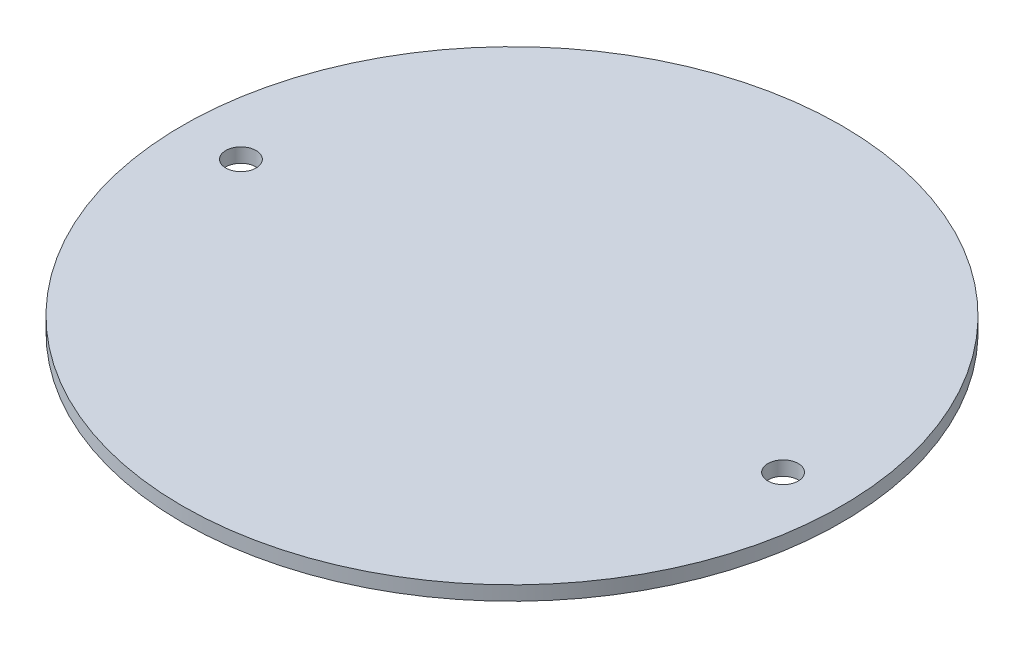
from build123d import *

# Parameters (mm, degrees)
SKETCH2_R               = 73.3425
BOSS_EXTRUDE1_DEPTH     = 3.175
F_1_4_CLEARANCE_HOLE1_D = 6.7564


with BuildPart() as part:
    # Sketch2 → Boss-Extrude1 (new body)
    with BuildSketch(Plane(origin=(0, 0, 0), x_dir=(1, 0, 0), z_dir=(0, 1, 0))):
        Circle(SKETCH2_R)
    extrude(amount=BOSS_EXTRUDE1_DEPTH)

    # 1/4 Clearance Hole1 (through all)
    with Locations(Plane(origin=(0, 3.175, 0), x_dir=(1, 0, 0), z_dir=(0, 1, 0))):
        with Locations((-60.325, 0), (60.325, 0)):
            Hole(F_1_4_CLEARANCE_HOLE1_D / 2)


solid = part.part
